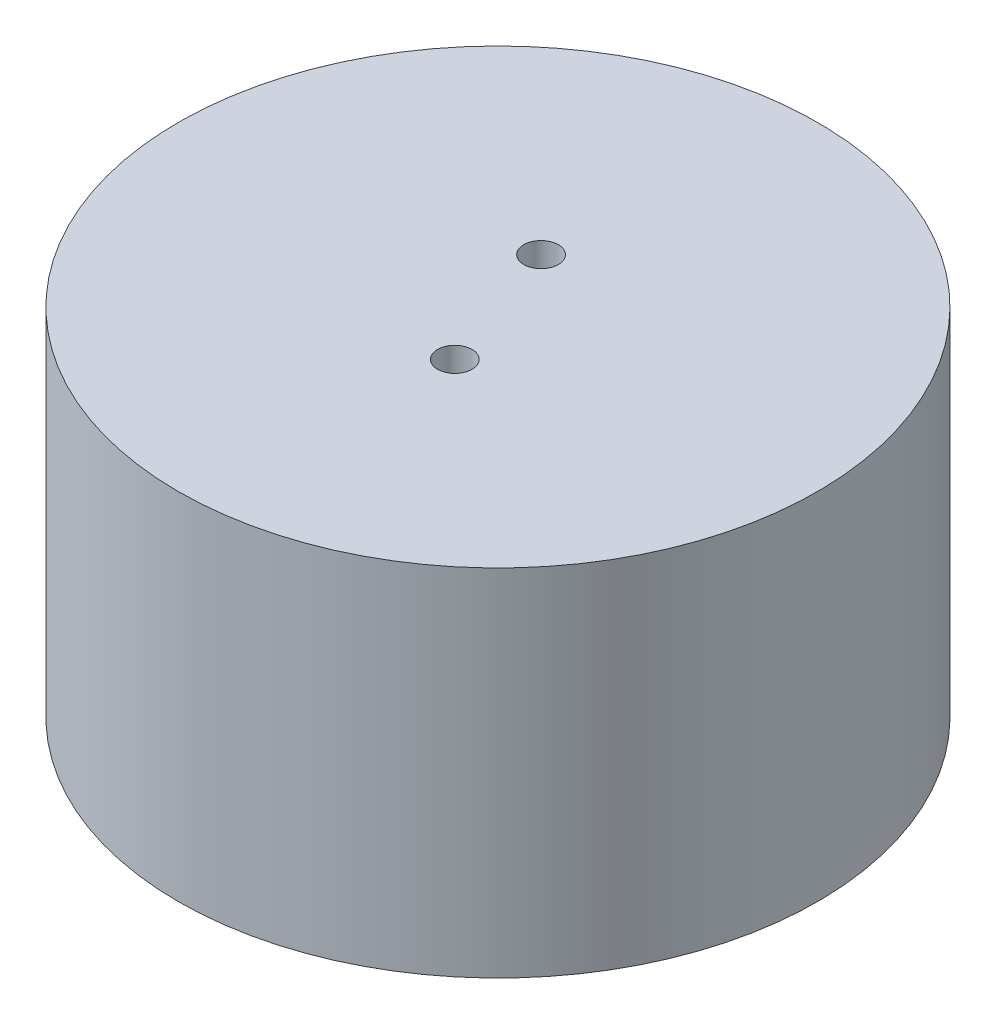
from build123d import *

# Parameters (mm, degrees)
SKETCH4_R                = 31.5
BOSS_EXTRUDE2_DEPTH      = 35
SKETCH3_R                = 26.5
CUT_EXTRUDE1_DEPTH       = 28
M3_CLEARANCE_HOLE1_D     = 3.4
M3_CLEARANCE_HOLE1_DEPTH = 50
M3_CLEARANCE_HOLE1_TIP   = 1.021463052


with BuildPart() as part:
    # Sketch4 → Boss-Extrude2 (new body)
    with BuildSketch(Plane(origin=(0, 0, 0), x_dir=(1, 0, 0), z_dir=(0, 1, 0))):
        Circle(SKETCH4_R)
    extrude(amount=BOSS_EXTRUDE2_DEPTH)

    # Sketch3 → Cut-Extrude1 (cut)
    with BuildSketch(Plane(origin=(0, 0, 0), x_dir=(1, 0, 0), z_dir=(0, 1, 0))):
        Circle(SKETCH3_R)
    extrude(amount=CUT_EXTRUDE1_DEPTH, mode=Mode.SUBTRACT)

    # M3 Clearance Hole1
    with Locations(Plane(origin=(0, 35, 0), x_dir=(1, 0, 0), z_dir=(0, 1, 0))):
        with Locations((-2.345047045, 6.595510166), (2.345047045, -6.595510166)):
            Hole(M3_CLEARANCE_HOLE1_D / 2, depth=M3_CLEARANCE_HOLE1_DEPTH)
            with Locations((0, 0, -(M3_CLEARANCE_HOLE1_DEPTH + M3_CLEARANCE_HOLE1_TIP / 2))):  # 118° drill point
                Cone(0, M3_CLEARANCE_HOLE1_D / 2, M3_CLEARANCE_HOLE1_TIP, mode=Mode.SUBTRACT)


solid = part.part
